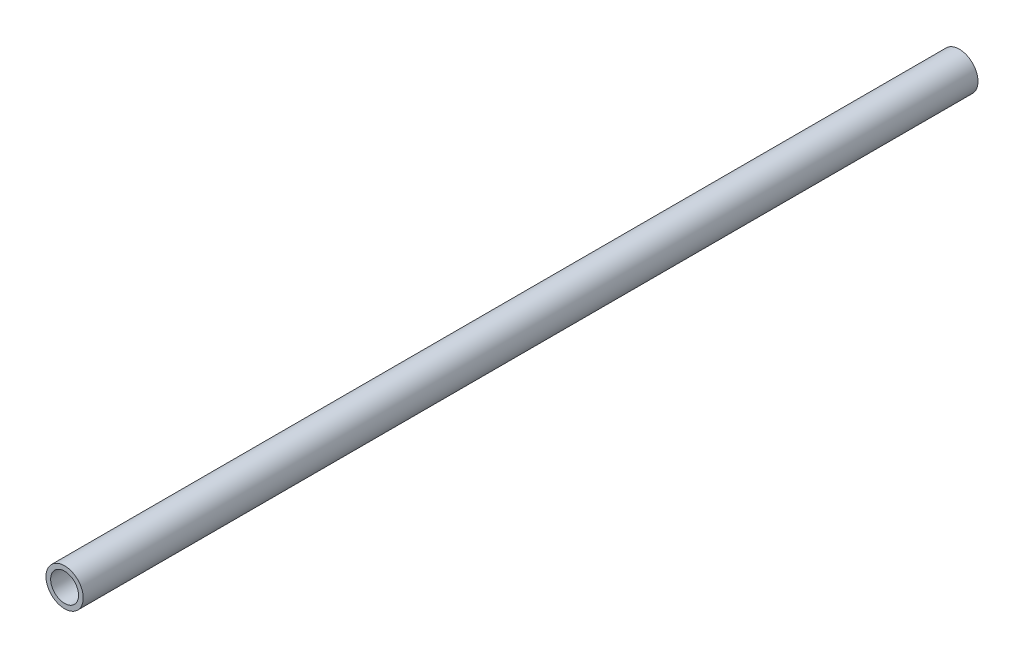
from build123d import *

# Parameters (mm, degrees)
SKETCH2_R           = 12.7
SKETCH2_R_2         = 9.525
BOSS_EXTRUDE1_DEPTH = 305.02479


with BuildPart() as part:
    # Sketch2 → Boss-Extrude1 (new, symmetric)
    with BuildSketch(Plane.XY):
        Circle(SKETCH2_R)
        Circle(SKETCH2_R_2, mode=Mode.SUBTRACT)
    extrude(amount=BOSS_EXTRUDE1_DEPTH, both=True)


solid = part.part
